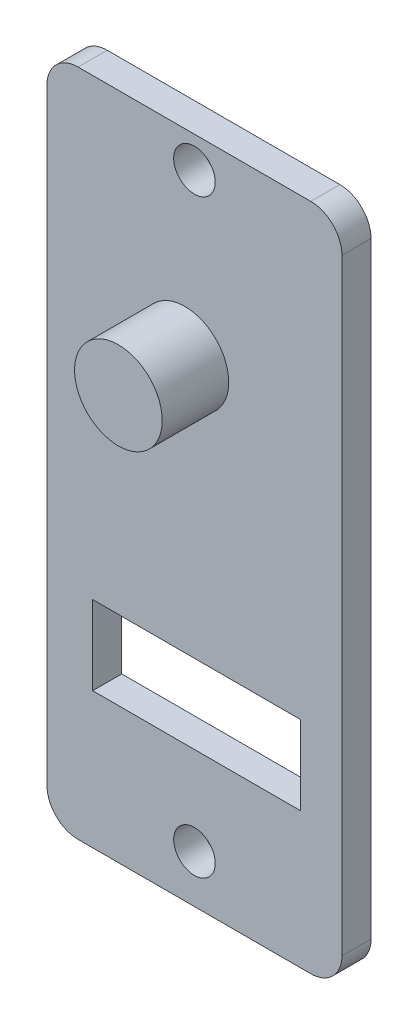
from build123d import *

# Parameters (mm, degrees)
SKETCH1_W           = 14.2
SKETCH1_H           = 32.2
BOSS_EXTRUDE1_DEPTH = 1.4
SKETCH2_R           = 1
SKETCH2_W           = 10
SKETCH2_H           = 3.8
CUT_EXTRUDE1_DEPTH  = 1.4
SKETCH3_R           = 2.11
BOSS_EXTRUDE2_DEPTH = 3.2
FILLET1_R           = 1.5


with BuildPart() as part:
    # Sketch1 → Boss-Extrude1 (new body)
    with BuildSketch(Plane.XY.offset(5)):
        with Locations((-99.59415338, 219.653192448)):
            Rectangle(SKETCH1_W, SKETCH1_H)
    extrude(amount=BOSS_EXTRUDE1_DEPTH)

    # Sketch2 → Cut-Extrude1 (cut)
    with BuildSketch(Plane.XY.offset(6.4)):
        with Locations((-99.59415338, 234.253192448)):
            Circle(SKETCH2_R)
        with Locations((-99.59415338, 205.853192448)):
            Circle(SKETCH2_R)
        with Locations((-99.49415338, 212.003192448)):
            Rectangle(SKETCH2_W, SKETCH2_H)
    extrude(amount=-CUT_EXTRUDE1_DEPTH, mode=Mode.SUBTRACT)

    # Sketch3 → Boss-Extrude2 (add)
    with BuildSketch(Plane.XY.offset(6.4)):
        with Locations((-100.055672153, 226.235056066)):
            Circle(SKETCH3_R)
    extrude(amount=BOSS_EXTRUDE2_DEPTH)

    # Fillet1
    fillet1_edges = [part.edges().sort_by_distance(p)[0] for p in [
        (-106.69415338, 203.553192448, 5.7),
        (-92.49415338, 203.553192448, 5.7),
        (-92.49415338, 235.753192448, 5.7),
        (-106.69415338, 235.753192448, 5.7),
    ]]
    fillet(fillet1_edges, radius=FILLET1_R)


solid = part.part
